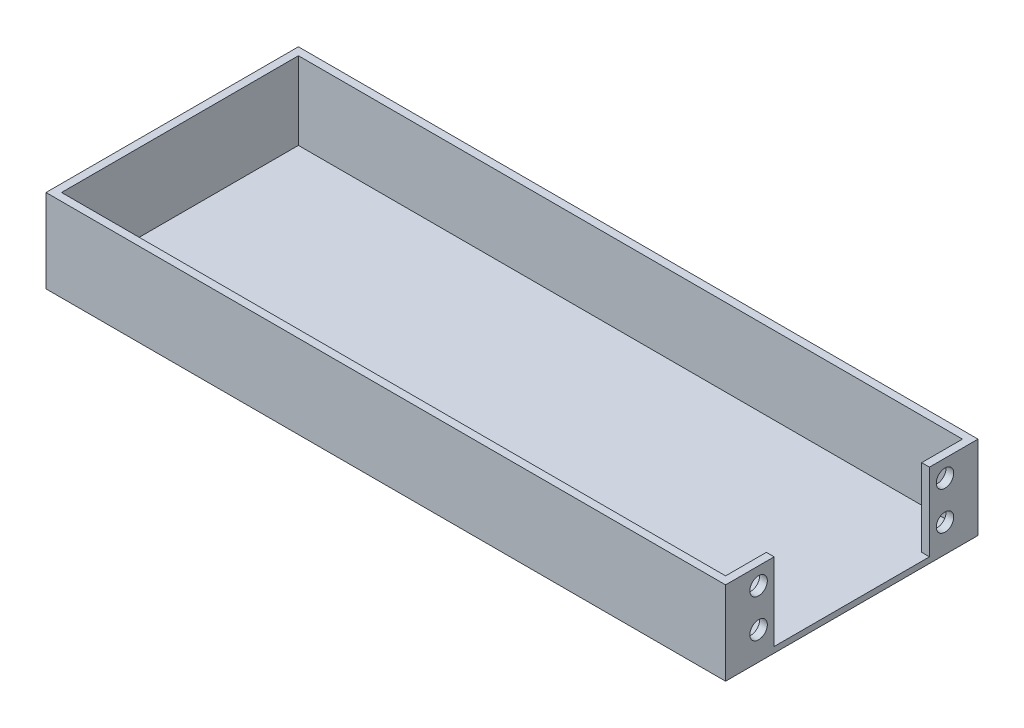
from build123d import *

# Parameters (mm, degrees)
SKETCH_1_W          = 175
SKETCH_1_H          = 65
EXTRUDE_1_DEPTH     = 1.5
SKETCH_3_W          = 175
SKETCH_3_H          = 65
SKETCH_3_W_2        = 171
SKETCH_3_H_2        = 61
EXTRUDE_2_DEPTH     = 20
SKETCH_4_W          = 40
SKETCH_4_H          = 20
CUT_EXTRUDE_1_DEPTH = 2
SKETCH_6_R          = 2.25
CUT_EXTRUDE_2_DEPTH = 2


with BuildPart() as part:
    # Эскиз1 → Бобышка-Вытянуть1 (new body)
    with BuildSketch(Plane(origin=(0, 0, 0), x_dir=(1, 0, 0), z_dir=(0, 1, 0))):
        Rectangle(SKETCH_1_W, SKETCH_1_H)
    extrude(amount=EXTRUDE_1_DEPTH)

    # Эскиз3 → Бобышка-Вытянуть2 (add)
    with BuildSketch(Plane(origin=(0, 1.5, 0), x_dir=(1, 0, 0), z_dir=(0, 1, 0))):
        Rectangle(SKETCH_3_W, SKETCH_3_H)
        Rectangle(SKETCH_3_W_2, SKETCH_3_H_2, mode=Mode.SUBTRACT)
    extrude(amount=EXTRUDE_2_DEPTH)

    # Эскиз4 → Вырез-Вытянуть1 (cut)
    with BuildSketch(Plane(origin=(87.5, 0, 0), x_dir=(0, 0, -1), z_dir=(1, 0, 0))):
        with Locations((0, 11.5)):
            Rectangle(SKETCH_4_W, SKETCH_4_H)
    extrude(amount=-CUT_EXTRUDE_1_DEPTH, mode=Mode.SUBTRACT)

    # Эскиз6 → Вырез-Вытянуть2 (cut)
    with BuildSketch(Plane(origin=(87.5, 0, 0), x_dir=(0, 0, -1), z_dir=(1, 0, 0))):
        with Locations((-24, 17.05)):
            Circle(SKETCH_6_R)
        with Locations((-24, 7.25)):
            Circle(SKETCH_6_R)
    cut_extrude_2 = extrude(amount=-CUT_EXTRUDE_2_DEPTH, mode=Mode.SUBTRACT)

    # Зеркальное отражение2: Вырез-Вытянуть2 across plane
    add(cut_extrude_2.mirror(Plane(origin=(0, 0, 0), x_dir=(1, 0, 0), z_dir=(0, 0, -1))), mode=Mode.SUBTRACT)


solid = part.part
